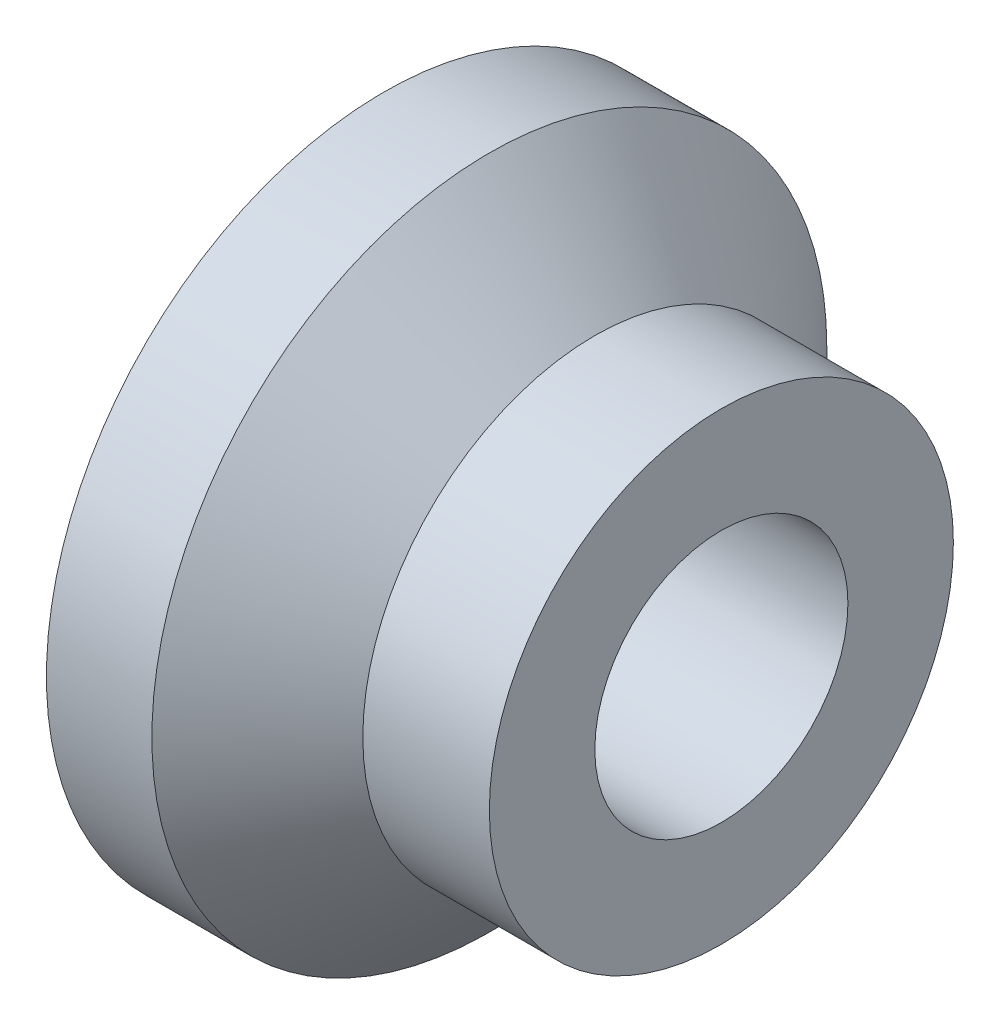
from build123d import *

# Parameters (mm, degrees)
SKETCH1_R           = 4
SKETCH1_R_2         = 1.5
BOSS_EXTRUDE1_DEPTH = 4
SKETCH2_OUTSIDE_W   = 12.4
SKETCH2_OUTSIDE_H   = 12.4
SKETCH2_OUTSIDE_R   = 2.75
CUT_EXTRUDE1_DEPTH  = 1.5
CHAMFER1_SIZE       = 1.25


with BuildPart() as part:
    # Sketch1 → Boss-Extrude1 (new body)
    with BuildSketch(Plane(origin=(0, 0, 0), x_dir=(0, 0, -1), z_dir=(1, 0, 0))):
        Circle(SKETCH1_R)
        Circle(SKETCH1_R_2, mode=Mode.SUBTRACT)
    extrude(amount=BOSS_EXTRUDE1_DEPTH)

    # Sketch2 outside → Cut-Extrude1 (cut)
    with BuildSketch(Plane(origin=(4, 0, 0), x_dir=(0, 0, -1), z_dir=(1, 0, 0))):
        Rectangle(SKETCH2_OUTSIDE_W, SKETCH2_OUTSIDE_H)
        Circle(SKETCH2_OUTSIDE_R, mode=Mode.SUBTRACT)
    extrude(amount=-CUT_EXTRUDE1_DEPTH, mode=Mode.SUBTRACT)

    # Chamfer1
    chamfer1_edges = [part.edges().sort_by_distance(p)[0] for p in [
        (2.5, 0, 4),
    ]]
    chamfer(chamfer1_edges, length=CHAMFER1_SIZE - 0.0001)  # a hair under: the kernel refuses the full size


solid = part.part
